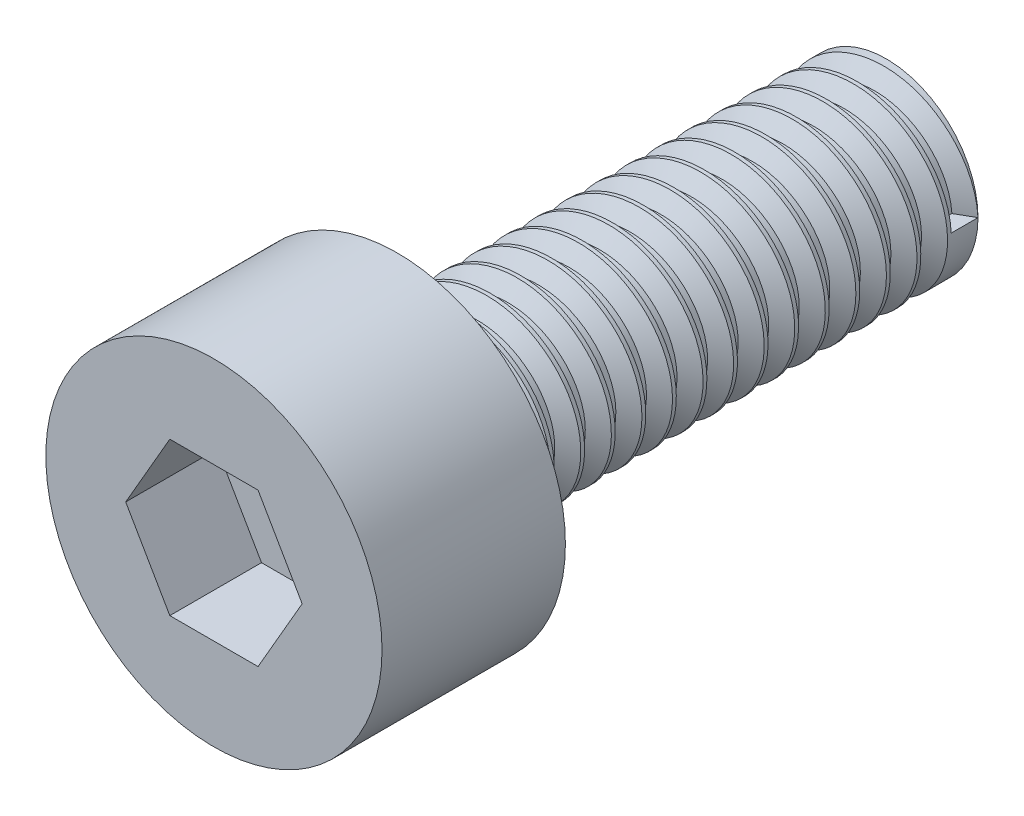
from build123d import *

# Parameters (mm, degrees)
SKETCH_1_R                = 1.5
EXTRUDE_3_10_DEPTH        = 8
M3X0_5_10_PITCH           = 0.5
SKETCH_2_R                = 2.75
EXTRUDE_5_5_3_DEPTH       = 3
CUT_EXTRUDE_2_5_1_5_DEPTH = 1.5


with BuildPart() as part:
    # Sketch 1 → 螺杆_直径3_长度10 (new body)
    with BuildSketch(Plane.XY):
        Circle(SKETCH_1_R)
    extrude(amount=EXTRUDE_3_10_DEPTH)

    # 真实螺纹_M3x0.5_右旋_长10: the profile of Sketch 1 2 profile screwed along a right-hand helix of 16 turns, 6 arcs to a turn; built about Z, then put on its axis
    m3x0_5_10_z = Axis((0, 0, 0), (0, 0, 1))
    m3x0_5_10_corners = [(1.5003, 0, -0.000173205), (1.5003, 0, 0.437673204), (1.229367063, 0, 0.281249999), (1.229367062, 0, 0.156249999)]
    with BuildLine(mode=Mode.PRIVATE) as m3x0_5_10_profile:
        Line(m3x0_5_10_corners[0], m3x0_5_10_corners[1])
        Line(m3x0_5_10_corners[1], m3x0_5_10_corners[2])
        Line(m3x0_5_10_corners[2], m3x0_5_10_corners[3])
        Line(m3x0_5_10_corners[3], m3x0_5_10_corners[0])
    m3x0_5_10_cap = Face(m3x0_5_10_profile.wire())
    m3x0_5_10_turn_angles = [0, 30, 60, 90, 120, 150, 180, 210, 240, 270, 300, 330, 360]
    m3x0_5_10_turn_weights = [1, 0.8660254037844387, 1, 0.8660254037844387, 1, 0.8660254037844387, 1, 0.8660254037844387, 1, 0.8660254037844387, 1, 0.8660254037844387, 1]
    m3x0_5_10_turn_rails = [Edge.make_bspline([Vector(p[0], p[1], 0).rotate(m3x0_5_10_z, m3x0_5_10_turn_angles[k]) / m3x0_5_10_turn_weights[k] + Vector(0, 0, p[2] + M3X0_5_10_PITCH * m3x0_5_10_turn_angles[k] / 360) for k in range(13)], [0, 0, 0, 1, 1, 2, 2, 3, 3, 4, 4, 5, 5, 6, 6, 6], 2, m3x0_5_10_turn_weights) for p in m3x0_5_10_corners]
    m3x0_5_10_turn_sides = [Face.make_surface_from_curves(m3x0_5_10_turn_rails[p[0]], m3x0_5_10_turn_rails[p[1]]) for p in [(0, 1), (1, 2), (2, 3), (3, 0)]]
    m3x0_5_10 = Plane(origin=(0, 0, 0), x_dir=(1, 0, 0), z_dir=(0, 0, 1)) * Solid(Shell([*[p.moved(Location((0, 0, M3X0_5_10_PITCH * i))) for i in range(16) for p in m3x0_5_10_turn_sides], m3x0_5_10_cap, m3x0_5_10_cap.rotate(m3x0_5_10_z, 5760).moved(Location((0, 0, M3X0_5_10_PITCH * 5760 / 360)))]))
    add(m3x0_5_10, mode=Mode.SUBTRACT)

    # 草图2 → 杯头_直径5.5_厚度3 (add)
    with BuildSketch(Plane.XY.offset(8)):
        Circle(SKETCH_2_R)
    extrude(amount=EXTRUDE_5_5_3_DEPTH)

    # 草图3 → 内六角_对边2.5_深1.5 (cut)
    with BuildSketch(Plane.XY.offset(11)):
        Polygon((1.443375673, 0), (0.721687836, 1.25), (-0.721687836, 1.25), (-1.443375673, 0), (-0.721687836, -1.25), (0.721687836, -1.25), align=None)
    extrude(amount=-CUT_EXTRUDE_2_5_1_5_DEPTH, mode=Mode.SUBTRACT)


solid = part.part
